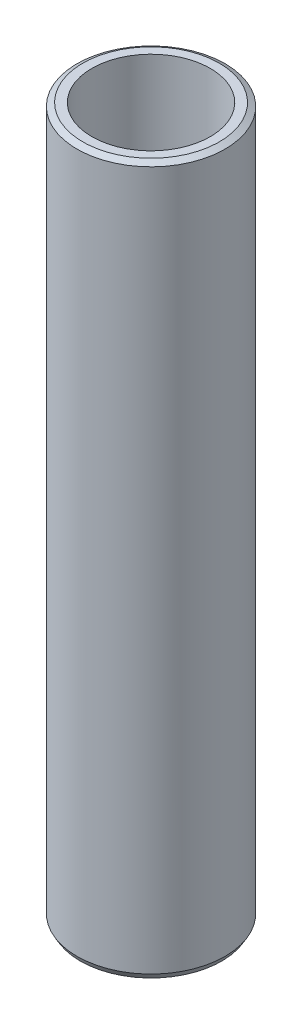
from build123d import *
from OCP.BRepFilletAPI import BRepFilletAPI_MakeChamfer

# Parameters (mm, degrees)
SKETCH1_R           = 25
BOSS_EXTRUDE1_DEPTH = 239.134616709
SKETCH2_R           = 19.99332415
CUT_EXTRUDE1_DEPTH  = 242.734078915
CHAMFER1_SIZE       = 1.131232549
CHAMFER1_SIZE2      = 1.95935225


with BuildPart() as part:
    # Sketch1 → Boss-Extrude1 (new body)
    with BuildSketch(Plane(origin=(0, 0, 0), x_dir=(1, 0, 0), z_dir=(0, 1, 0))):
        Circle(SKETCH1_R)
    extrude(amount=BOSS_EXTRUDE1_DEPTH)

    # Sketch2 → Cut-Extrude1 (cut, through all)
    with BuildSketch(Plane(origin=(0, 0, 0), x_dir=(1, 0, 0), z_dir=(0, 1, 0))):
        Circle(SKETCH2_R)
    extrude(amount=CUT_EXTRUDE1_DEPTH, mode=Mode.SUBTRACT)

    # Chamfer1: one chamfer whose edges measure the first distance from different faces: ONE call of the kernel's chamfer builder (chamfer() names one face for all edges)
    chamfer1_edges_1 = [part.edges().sort_by_distance(p)[0] for p in [
        (-25, 239.134616709, 0),
    ]]
    chamfer1_side_1 = [part.faces().sort_by_distance(p)[0] for p in [
        (-25, 119.567308355, 0),
    ]]
    chamfer1_edges_2 = [part.edges().sort_by_distance(p)[0] for p in [
        (-25, 0, 0),
    ]]
    chamfer1_side_2 = [part.faces().sort_by_distance(p)[0] for p in [
        (-24.292893219, 0, 0),
    ]]
    chamfer1 = BRepFilletAPI_MakeChamfer(part.part.solid().wrapped)
    for e in chamfer1_edges_1:
        chamfer1.Add(CHAMFER1_SIZE, CHAMFER1_SIZE2, e.wrapped, chamfer1_side_1[0].wrapped)  # the first distance lies on this face
    for e in chamfer1_edges_2:
        chamfer1.Add(CHAMFER1_SIZE, CHAMFER1_SIZE2, e.wrapped, chamfer1_side_2[0].wrapped)  # the first distance lies on this face
    add(Compound.cast(chamfer1.Shape()), mode=Mode.REPLACE)


solid = part.part
